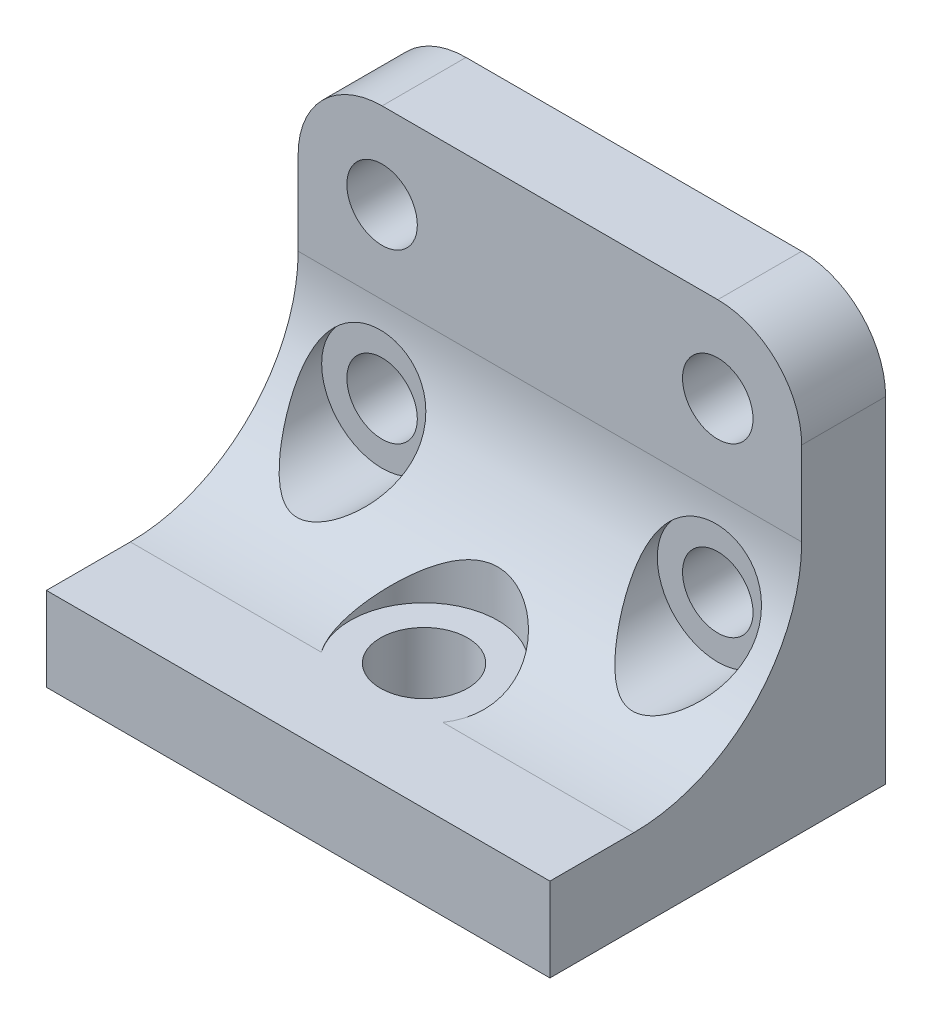
from build123d import *

# Parameters (mm, degrees)
SKETCH1_R           = 2.1
BOSS_EXTRUDE1_DEPTH = 5
SKETCH3_W           = 30
SKETCH3_H           = 5
BOSS_EXTRUDE2_DEPTH = 15
FILLET1_R           = 5
SKETCH4_R           = 2.6
CUT_EXTRUDE2_DEPTH  = 108.425323176
FILLET2_R           = 10
SKETCH5_R           = 4.4
CUT_EXTRUDE3_DEPTH  = 108.425323272
SKETCH2_R           = 3.6
CUT_EXTRUDE4_DEPTH  = 114.974558916


with BuildPart() as part:
    # Sketch1 → Boss-Extrude1 (new body)
    with BuildSketch(Plane.XY):
        Polygon((73.634936481, -21), (73.634936481, -20), (103.634936481, -20), (103.634936481, -21), (103.634936481, -45), (73.634936481, -45), align=None)
        with Locations((98.634936481, -35.1)):
            Circle(SKETCH1_R, mode=Mode.SUBTRACT)
        with Locations((78.634936481, -35.1)):
            Circle(SKETCH1_R, mode=Mode.SUBTRACT)
        with Locations((98.634936481, -25.1)):
            Circle(SKETCH1_R, mode=Mode.SUBTRACT)
        with Locations((78.634936481, -25.1)):
            Circle(SKETCH1_R, mode=Mode.SUBTRACT)
    extrude(amount=BOSS_EXTRUDE1_DEPTH)

    # Sketch3 → Boss-Extrude2 (add)
    with BuildSketch(Plane.XY.offset(5)):
        with Locations((88.634936481, -42.5)):
            Rectangle(SKETCH3_W, SKETCH3_H)
    extrude(amount=BOSS_EXTRUDE2_DEPTH)

    # Fillet1
    fillet1_edges = [part.edges().sort_by_distance(p)[0] for p in [
        (103.634936481, -20, 2.5),
        (73.634936481, -20, 2.5),
    ]]
    fillet(fillet1_edges, radius=FILLET1_R)

    # Sketch4 → Cut-Extrude2 (cut, through all)
    with BuildSketch(Plane(origin=(0, -40, 0), x_dir=(1, 0, 0), z_dir=(0, 1, 0))):
        with Locations(Location((88.634936481, -12.5, 0), (0, 0, 180))):
            Circle(SKETCH4_R)
    extrude(amount=-CUT_EXTRUDE2_DEPTH, mode=Mode.SUBTRACT)

    # Fillet2
    # the kernel refuses this fillet: 10 mm, written as the material it adds along each edge
    with BuildSketch(Plane(origin=(73.634936481, -40, 5), x_dir=(0, 1, 0), z_dir=(1, 0, 0))) as fillet2_piece_1_section:
        with BuildLine():
            CenterArc((FILLET2_R, FILLET2_R), FILLET2_R, 180, 90)
            Line((0, FILLET2_R), (0, 0))
            Line((0, 0), (FILLET2_R, 0))
        make_face()
    fillet2_piece_1 = extrude(amount=30, mode=Mode.PRIVATE)
    fillet2_piece_1 = fillet2_piece_1 - Plane(origin=(98.634936481, -35.1, 7.280397509), x_dir=(1, 0, 0), z_dir=(0, 0, -1)) * Cylinder(2.1, 100, mode=Mode.PRIVATE)
    fillet2_piece_1 = fillet2_piece_1 - Plane(origin=(78.634936481, -35.1, 7.280397509), x_dir=(1, 0, 0), z_dir=(0, 0, -1)) * Cylinder(2.1, 100, mode=Mode.PRIVATE)
    fillet2_piece_1 = fillet2_piece_1 - Plane(origin=(88.634936481, -37.846705327, 12.5), x_dir=(-1, 0, 0), z_dir=(0, 1, 0)) * Cylinder(2.6, 100, mode=Mode.PRIVATE)
    add(fillet2_piece_1)

    # Sketch5 → Cut-Extrude3 (cut, through all)
    with BuildSketch(Plane(origin=(0, -40, 0), x_dir=(1, 0, 0), z_dir=(0, 1, 0))):
        with Locations((88.634936481, -12.5)):
            Circle(SKETCH5_R)
    extrude(amount=CUT_EXTRUDE3_DEPTH, mode=Mode.SUBTRACT)

    # Sketch2 → Cut-Extrude4 (cut, through all)
    with BuildSketch(Plane.XY.offset(5)):
        with Locations((98.634936481, -25.1)):
            Circle(SKETCH2_R)
        with Locations(Location((98.634936481, -35.1, 0), (0, 0, 180))):
            Circle(SKETCH2_R)
        with Locations((78.634936481, -25.1)):
            Circle(SKETCH2_R)
        with Locations(Location((78.634936481, -35.1, 0), (0, 0, 180))):
            Circle(SKETCH2_R)
    extrude(amount=CUT_EXTRUDE4_DEPTH, mode=Mode.SUBTRACT)


solid = part.part
